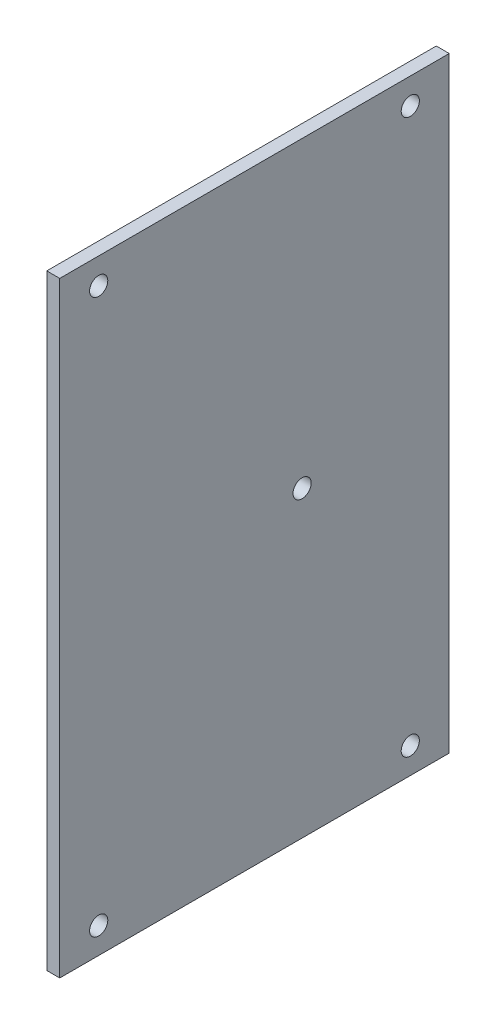
from build123d import *

# Parameters (mm, degrees)
SKETCH1_W           = 90
SKETCH1_H           = 140
SKETCH1_R           = 2.1
BOSS_EXTRUDE1_DEPTH = 3


with BuildPart() as part:
    # Sketch1 → Boss-Extrude1 (new body)
    with BuildSketch(Plane(origin=(0, 0, 0), x_dir=(0, 0, -1), z_dir=(1, 0, 0))):
        with Locations((45, -70)):
            Rectangle(SKETCH1_W, SKETCH1_H)
        with Locations((56, -70)):
            Circle(SKETCH1_R, mode=Mode.SUBTRACT)
        with Locations((9, -6)):
            Circle(SKETCH1_R, mode=Mode.SUBTRACT)
        with Locations((81, -6)):
            Circle(SKETCH1_R, mode=Mode.SUBTRACT)
        with Locations((81, -134)):
            Circle(SKETCH1_R, mode=Mode.SUBTRACT)
        with Locations((9, -134)):
            Circle(SKETCH1_R, mode=Mode.SUBTRACT)
    extrude(amount=BOSS_EXTRUDE1_DEPTH)


solid = part.part
